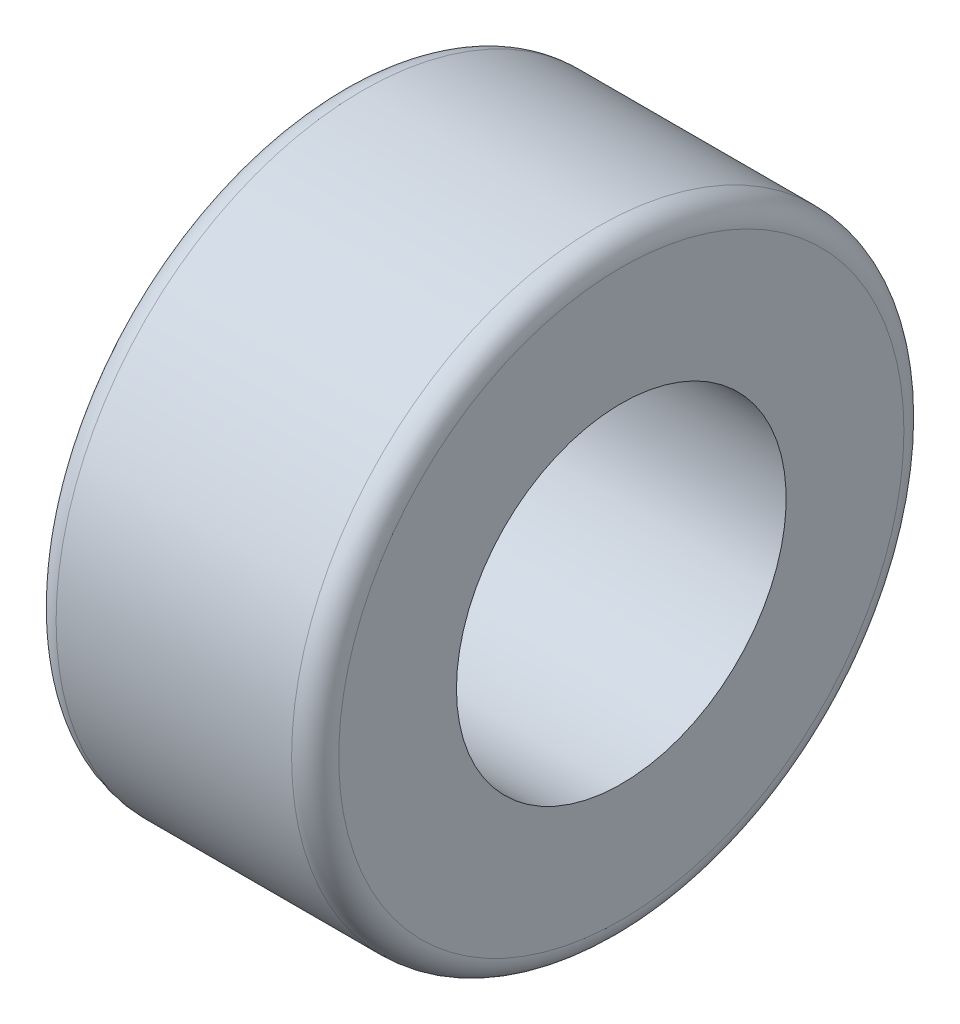
from build123d import *

# Parameters (mm, degrees)
SKETCH1_R           = 165.1
SKETCH1_R_2         = 88.9
BOSS_EXTRUDE1_DEPTH = 152.4
FILLET1_R           = 12.7
SHELL2_START        = 12.7
SHELL2_OUTLINE_R    = 152.4
SHELL2_OUTLINE_R_2  = 101.6
SHELL2_DEPTH        = 127


# Read off the part's stored shape, not the designer's step: Shell2
with BuildPart() as part:
    # Sketch1 → Boss-Extrude1 (new body)
    with BuildSketch(Plane(origin=(0, 0, 0), x_dir=(0, 0, -1), z_dir=(1, 0, 0))):
        with Locations(Location((0, 0, 0), (0, 0, 180))):
            Circle(SKETCH1_R)
        with Locations(Location((0, 0, 0), (0, 0, 180))):
            Circle(SKETCH1_R_2, mode=Mode.SUBTRACT)
    extrude(amount=BOSS_EXTRUDE1_DEPTH)

    # Fillet1
    fillet1_edges = [part.edges().sort_by_distance(p)[0] for p in [
        (0, 0, -165.1),
        (152.4, 0, -165.1),
    ]]
    fillet(fillet1_edges, radius=FILLET1_R)

    # Shell2 outline → Shell2 (cut)
    with BuildSketch(Plane.YZ.offset(SHELL2_START)):
        Circle(SHELL2_OUTLINE_R)
        Circle(SHELL2_OUTLINE_R_2, mode=Mode.SUBTRACT)
    extrude(amount=SHELL2_DEPTH, mode=Mode.SUBTRACT)


solid = part.part
